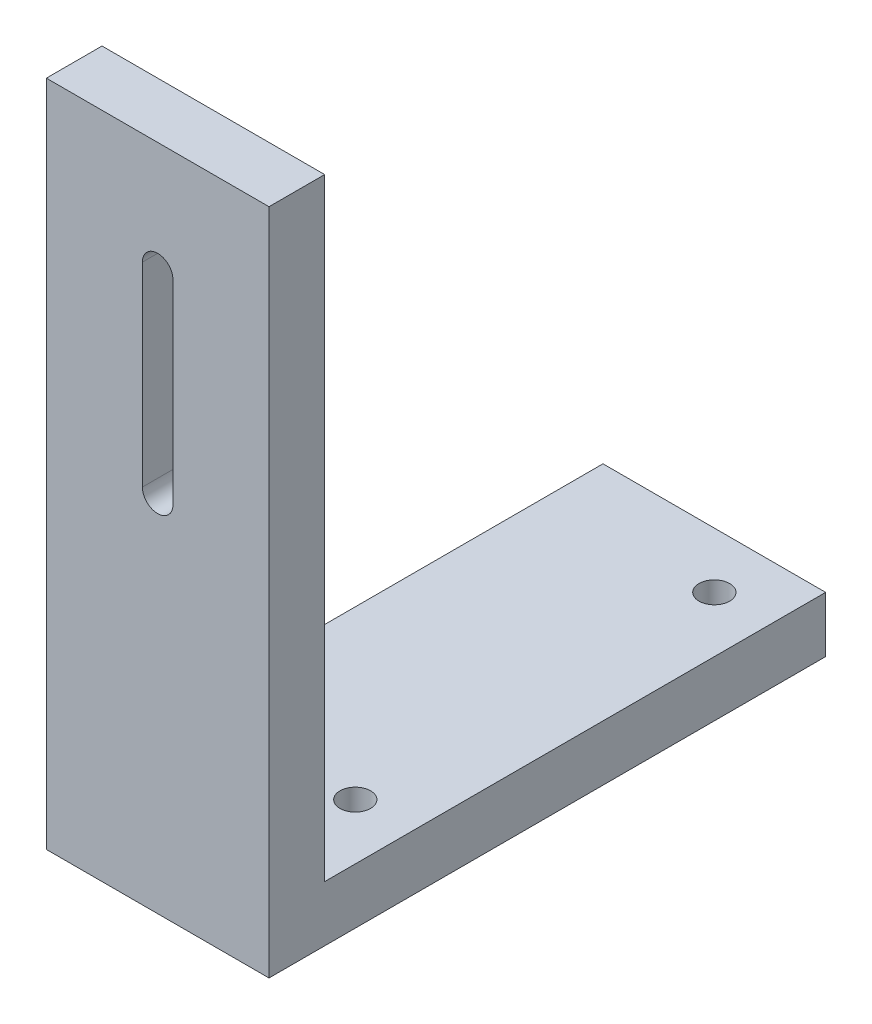
from build123d import *

# Parameters (mm, degrees)
SKETCH_1_W          = 40
SKETCH_1_H          = 10
EXTRUDE_1_DEPTH     = 100
SKETCH_3_R          = 2.75
CUT_EXTRUDE_1_DEPTH = 104.109784618
SKETCH_5_W          = 40
SKETCH_5_H          = 10
EXTRUDE_2_DEPTH     = 110
CUT_EXTRUDE_2_DEPTH = 148.839871767


with BuildPart() as part:
    # 草圖1 → 填料-伸長1 (new body)
    with BuildSketch(Plane.XY):
        with Locations((-3.057052805, 0)):
            Rectangle(SKETCH_1_W, SKETCH_1_H)
    extrude(amount=EXTRUDE_1_DEPTH)

    # 草圖3 → 除料-伸長1 (cut, through all)
    with BuildSketch(Plane(origin=(0, 5, 0), x_dir=(1, 0, 0), z_dir=(0, 1, 0))):
        with Locations((6.942947195, -10)):
            Circle(SKETCH_3_R)
        with Locations((6.942947195, -74.5)):
            Circle(SKETCH_3_R)
    extrude(amount=-CUT_EXTRUDE_1_DEPTH, mode=Mode.SUBTRACT)

    # 草圖5 → 填料-伸長2 (add)
    with BuildSketch(Plane(origin=(0, 5, 0), x_dir=(1, 0, 0), z_dir=(0, 1, 0))):
        with Locations((-3.057052805, -95)):
            Rectangle(SKETCH_5_W, SKETCH_5_H)
    extrude(amount=EXTRUDE_2_DEPTH)

    # 草圖7 → 除料-伸長2 (cut, through all)
    with BuildSketch(Plane(origin=(0, 0, 90), x_dir=(-1, 0, 0), z_dir=(0, 0, -1))):
        with BuildLine():
            Line((5.807052805, 95), (5.807052805, 60))
            ThreePointArc((5.807052805, 60), (3.057052805, 57.25), (0.307052805, 60))
            Line((0.307052805, 60), (0.307052805, 95))
            ThreePointArc((0.307052805, 95), (3.057052805, 97.75), (5.807052805, 95))
        make_face()
    extrude(amount=-CUT_EXTRUDE_2_DEPTH, mode=Mode.SUBTRACT)


solid = part.part
